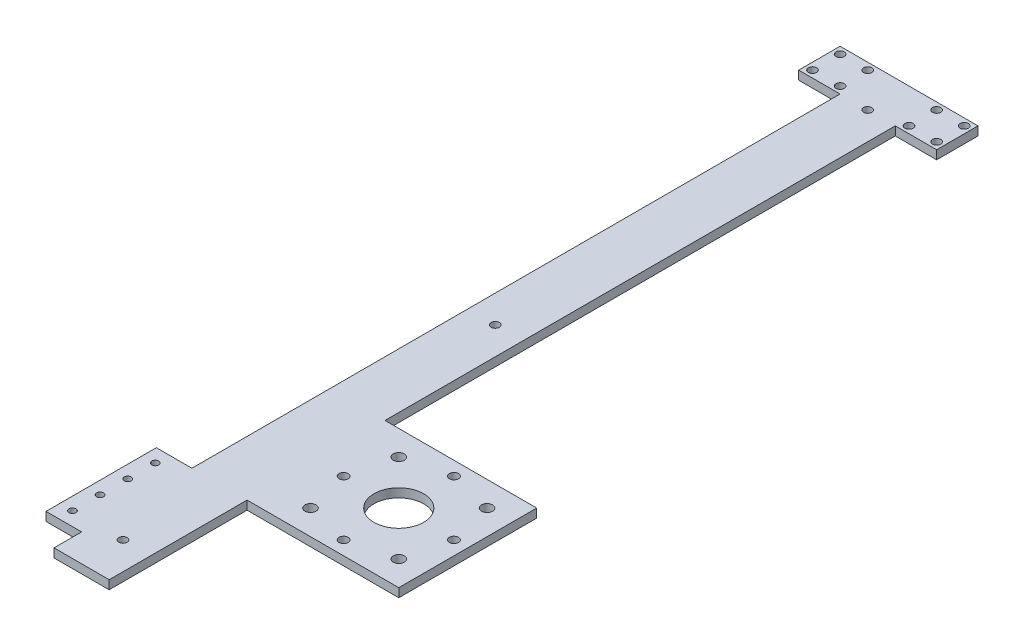
from build123d import *

# Parameters (mm, degrees)
SKETCH1_R           = 2
SKETCH1_R_2         = 9
SKETCH1_R_3         = 1.25
BOSS_EXTRUDE1_DEPTH = 3.175
SKETCH2_R           = 1.65
CUT_EXTRUDE1_DEPTH  = 164.508656116
SKETCH3_R           = 1.5
CUT_EXTRUDE2_DEPTH  = 164.508656116
SKETCH4_W           = 15
SKETCH4_H           = 15
SKETCH4_R           = 1.5
BOSS_EXTRUDE2_DEPTH = 3.175


with BuildPart() as part:
    # Sketch1 → Boss-Extrude1 (new body)
    with BuildSketch(Plane(origin=(0, 0, 0), x_dir=(1, 0, 0), z_dir=(0, 1, 0))):
        Polygon((65, -50), (10, -50), (10, 150), (-10, 150), (-10, -100), (-22.9, -100), (-22.9, -140), (-10, -140), (-10, -150), (0, -150), (10, -150), (10, -100), (65, -100), align=None)
        with Locations((24, -59)):
            Circle(SKETCH1_R, mode=Mode.SUBTRACT)
        with Locations((24, -91)):
            Circle(SKETCH1_R, mode=Mode.SUBTRACT)
        with Locations((56, -91)):
            Circle(SKETCH1_R, mode=Mode.SUBTRACT)
        with Locations((56, -59)):
            Circle(SKETCH1_R, mode=Mode.SUBTRACT)
        with Locations((40, -75)):
            Circle(SKETCH1_R_2, mode=Mode.SUBTRACT)
        with Locations((-18.3, -105)):
            Circle(SKETCH1_R_3, mode=Mode.SUBTRACT)
        with Locations((-18.3, -135)):
            Circle(SKETCH1_R_3, mode=Mode.SUBTRACT)
        with Locations((-18.3, -125)):
            Circle(SKETCH1_R_3, mode=Mode.SUBTRACT)
        with Locations((-18.3, -115)):
            Circle(SKETCH1_R_3, mode=Mode.SUBTRACT)
    extrude(amount=BOSS_EXTRUDE1_DEPTH)

    # Sketch2 → Cut-Extrude1 (cut, through all)
    with BuildSketch(Plane(origin=(0, 3.175, 0), x_dir=(1, 0, 0), z_dir=(0, 1, 0))):
        with Locations((60, -75)):
            Circle(SKETCH2_R)
        with Locations((40, -55)):
            Circle(SKETCH2_R)
        with Locations((40, -95)):
            Circle(SKETCH2_R)
        with Locations((20, -75)):
            Circle(SKETCH2_R)
    extrude(amount=-CUT_EXTRUDE1_DEPTH, mode=Mode.SUBTRACT)

    # Sketch3 → Cut-Extrude2 (cut, through all)
    with BuildSketch(Plane(origin=(0, 3.175, 0), x_dir=(1, 0, 0), z_dir=(0, 1, 0))):
        Circle(SKETCH3_R)
        with Locations((0, -135)):
            Circle(SKETCH3_R)
        with Locations((0, 135)):
            Circle(SKETCH3_R)
    extrude(amount=-CUT_EXTRUDE2_DEPTH, mode=Mode.SUBTRACT)

    # Sketch4 → Boss-Extrude2 (add)
    # profile 1 of 2: a face of its own
    with BuildSketch(Plane(origin=(0, 3.175, 0), x_dir=(1, 0, 0), z_dir=(0, 1, 0))):
        with Locations((17.5, 142.5)):
            Rectangle(SKETCH4_W, SKETCH4_H)
        with Locations((12.5, 147.5)):
            Circle(SKETCH4_R, mode=Mode.SUBTRACT)
        with Locations((12.5, 137.5)):
            Circle(SKETCH4_R, mode=Mode.SUBTRACT)
        with Locations((22.5, 137.5)):
            Circle(SKETCH4_R, mode=Mode.SUBTRACT)
        with Locations((22.5, 147.5)):
            Circle(SKETCH4_R, mode=Mode.SUBTRACT)
    # profile 2 of 2: a face of its own
    with BuildSketch(Plane(origin=(0, 3.175, 0), x_dir=(1, 0, 0), z_dir=(0, 1, 0))):
        with Locations((-17.5, 142.5)):
            Rectangle(SKETCH4_W, SKETCH4_H)
        with Locations((-22.5, 137.5)):
            Circle(SKETCH4_R, mode=Mode.SUBTRACT)
        with Locations((-12.5, 137.5)):
            Circle(SKETCH4_R, mode=Mode.SUBTRACT)
        with Locations((-22.5, 147.5)):
            Circle(SKETCH4_R, mode=Mode.SUBTRACT)
        with Locations((-12.5, 147.5)):
            Circle(SKETCH4_R, mode=Mode.SUBTRACT)
    extrude(amount=-BOSS_EXTRUDE2_DEPTH)


solid = part.part
